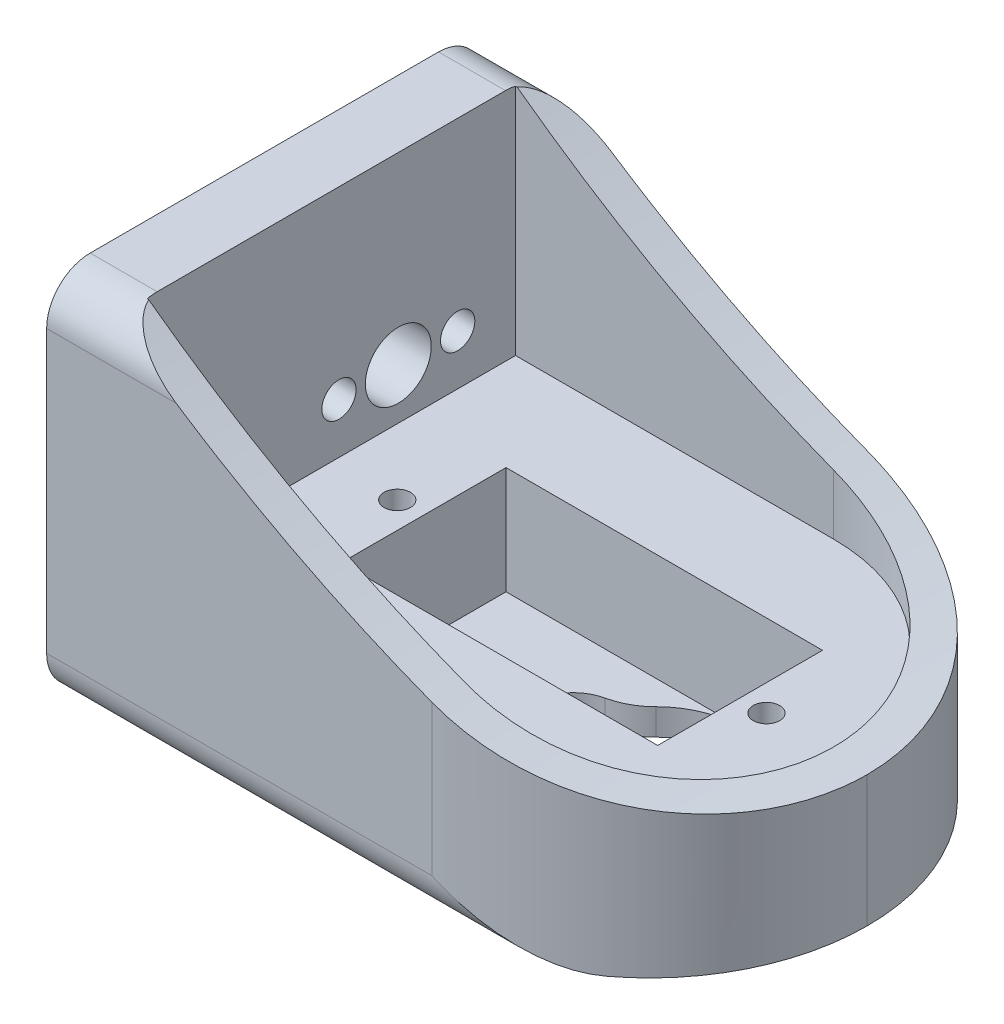
from build123d import *
from OCP.BRepFilletAPI import BRepFilletAPI_MakeFillet

# Parameters (mm, degrees)
BOSS_EXTRUDE1_DEPTH       = 45.72
CUT_EXTRUDE1_DEPTH        = 59.101632507
FILLET2_R                 = 16.51
FILLET3_R                 = 16.51
SKETCH3_OUTSIDE_W         = 60.308
SKETCH3_OUTSIDE_H         = 47.608
CUT_EXTRUDE2_DEPTH        = 52.759317573
SKETCH5_W                 = 24.000000006
SKETCH5_H                 = 12.5
CUT_EXTRUDE3_DEPTH        = 8.16
CUT_EXTRUDE4_DEPTH        = 56.097932423
FILLET4_R1                = 3
FILLET4_R2                = 5
F_2_0MM_DOWEL_HOLE1_D     = 2
F_2_0MM_DOWEL_HOLE1_DEPTH = 8
F_2_0MM_DOWEL_HOLE1_TIP   = 0.600860619
SKETCH11_R                = 2.5
SKETCH11_R_2              = 1.3
CUT_EXTRUDE6_DEPTH        = 5.08
CUT_EXTRUDE7_DEPTH        = 1.5


with BuildPart() as part:
    # Sketch1 → Boss-Extrude1 (new body)
    with BuildSketch(Plane.YZ):
        with BuildLine():
            Line((10.668, -16.51), (-10.668, -16.51))
            ThreePointArc((-10.668, -16.51), (-13.002866591, -15.542866591), (-13.97, -13.208))
            Line((-13.97, -13.208), (-13.97, 13.208))
            ThreePointArc((-13.97, 13.208), (-13.002866591, 15.542866591), (-10.668, 16.51))
            Line((-10.668, 16.51), (10.668, 16.51))
            ThreePointArc((10.668, 16.51), (13.002866591, 15.542866591), (13.97, 13.208))
            Line((13.97, 13.208), (13.97, -13.208))
            ThreePointArc((13.97, -13.208), (13.002866591, -15.542866591), (10.668, -16.51))
        make_face()
    extrude(amount=BOSS_EXTRUDE1_DEPTH)

    # Sketch2 → Cut-Extrude1 (cut, through all)
    with BuildSketch(Plane(origin=(0, 0, -16.51), x_dir=(1, 0, 0), z_dir=(0, 0, -1))):
        with BuildLine():
            Line((5.08, -13.97), (45.72, -13.97))
            Line((45.72, -13.97), (45.72, 4.03))
            add(Edge.make_bspline(
                [(5.08, -13.97), (23.327246471, -0.48405524), (45.72, 4.03)],
                knots=[0, 0, 0, 1, 1, 1], degree=2))
        make_face()
    extrude(amount=-CUT_EXTRUDE1_DEPTH, mode=Mode.SUBTRACT)

    # Fillet2
    # the kernel refuses this fillet: 16.51 mm, written as the material it takes off along each edge
    with BuildSketch(Plane(origin=(45.72, 37.245, -16.51), x_dir=(-1, 0, 0), z_dir=(0, -1, 0))) as fillet2_piece_1:
        with BuildLine():
            CenterArc((FILLET2_R, -FILLET2_R), FILLET2_R, 90, 90)
            Line((0, -FILLET2_R), (0, 0))
            Line((0, 0), (FILLET2_R, 0))
        make_face()
    extrude(amount=89.188, mode=Mode.SUBTRACT)

    # Fillet3
    # the kernel refuses this fillet: 16.51 mm, written as the material it takes off along each edge
    with BuildSketch(Plane(origin=(45.72, -51.943, 16.51), x_dir=(-1, 0, 0), z_dir=(0, 1, 0))) as fillet3_piece_1:
        with BuildLine():
            CenterArc((FILLET3_R, -FILLET3_R), FILLET3_R, 90, 90)
            Line((0, -FILLET3_R), (0, 0))
            Line((0, 0), (FILLET3_R, 0))
        make_face()
    extrude(amount=89.188, mode=Mode.SUBTRACT)

    # Sketch3 outside → Cut-Extrude2 (cut, through all)
    # profile 1 of 2: a face of its own
    with BuildSketch(Plane(origin=(0, -3.81, 0), x_dir=(-1, 0, 0), z_dir=(0, -1, 0))):
        with Locations((-22.86, 0)):
            Rectangle(SKETCH3_OUTSIDE_W, SKETCH3_OUTSIDE_H)
        with BuildLine():
            Line((-29.21, -16.51), (0, -16.51))
            Line((0, -16.51), (0, 16.51))
            Line((0, 16.51), (-29.21, 16.51))
            ThreePointArc((-29.21, 16.51), (-45.72, 0), (-29.21, -16.51))
        make_face(mode=Mode.SUBTRACT)
    # profile 2 of 2: a face of its own
    with BuildSketch(Plane(origin=(0, -3.81, 0), x_dir=(-1, 0, 0), z_dir=(0, -1, 0))):
        with BuildLine():
            Line((-29.21, -13.97), (-5.08, -13.97))
            Line((-5.08, -13.97), (-5.08, 13.97))
            Line((-5.08, 13.97), (-29.21, 13.97))
            ThreePointArc((-29.21, 13.97), (-43.18, 0), (-29.21, -13.97))
        make_face()
    extrude(amount=-CUT_EXTRUDE2_DEPTH, mode=Mode.SUBTRACT)

    # Sketch5 → Cut-Extrude3 (cut)
    with BuildSketch(Plane(origin=(0, -3.81, 0), x_dir=(-1, 0, 0), z_dir=(0, -1, 0))):
        with Locations((-24.080000003, 0)):
            Rectangle(SKETCH5_W, SKETCH5_H)
    extrude(amount=CUT_EXTRUDE3_DEPTH, mode=Mode.SUBTRACT)

    # Sketch6 → Cut-Extrude4 (cut, through all)
    with BuildSketch(Plane(origin=(0, -11.97, 0), x_dir=(-1, 0, 0), z_dir=(0, 1, 0))):
        with BuildLine():
            ThreePointArc((-24.267500006, 3.099974385), (-36.080000006, 0.05), (-24.267500006, -2.999974385))
            ThreePointArc((-24.267500006, -2.999974385), (-20.330000006, 0.05), (-24.267500006, 3.099974385))
        make_face()
    extrude(amount=-CUT_EXTRUDE4_DEPTH, mode=Mode.SUBTRACT)

    # Fillet4: one fillet with a radius per group of edges: ONE call of the kernel's fillet builder (fillet() takes one radius for all edges)
    fillet4_edges_1 = [part.edges().sort_by_distance(p)[0] for p in [
        (24.267500006, -12.97, 3.099974385),
    ]]
    fillet4_edges_2 = [part.edges().sort_by_distance(p)[0] for p in [
        (24.267500006, -12.97, -2.999974385),
    ]]
    fillet4 = BRepFilletAPI_MakeFillet(part.part.solid().wrapped)
    for e in fillet4_edges_1:
        fillet4.Add(FILLET4_R1, e.wrapped)
    for e in fillet4_edges_2:
        fillet4.Add(FILLET4_R2, e.wrapped)
    add(Compound.cast(fillet4.Shape()), mode=Mode.REPLACE)

    # Ø2.0mm Dowel Hole1
    with Locations(Plane(origin=(0, -3.81, 0), x_dir=(-1, 0, 0), z_dir=(0, 1, 0))):
        with Locations((-10.08, 0), (-38.080000006, 0)):
            Hole(F_2_0MM_DOWEL_HOLE1_D / 2, depth=F_2_0MM_DOWEL_HOLE1_DEPTH)
            with Locations((0, 0, -(F_2_0MM_DOWEL_HOLE1_DEPTH + F_2_0MM_DOWEL_HOLE1_TIP / 2))):  # 118° drill point
                Cone(0, F_2_0MM_DOWEL_HOLE1_D / 2, F_2_0MM_DOWEL_HOLE1_TIP, mode=Mode.SUBTRACT)

    # Sketch11 → Cut-Extrude6 (cut)
    with BuildSketch(Plane(origin=(0, 0, 0), x_dir=(0, -1, 0), z_dir=(-1, 0, 0))):
        with Locations(Location((0, -5.08, 0), (0, 0, 90))):
            Circle(SKETCH11_R)
        with Locations(Location((0, -0.58, 0), (0, 0, 90))):
            Circle(SKETCH11_R_2)
        with Locations(Location((0, -9.58, 0), (0, 0, 90))):
            Circle(SKETCH11_R_2)
    extrude(amount=-CUT_EXTRUDE6_DEPTH, mode=Mode.SUBTRACT)

    # Sketch12 → Cut-Extrude7 (cut)
    with BuildSketch(Plane(origin=(0, 0, 0), x_dir=(0, -1, 0), z_dir=(-1, 0, 0))):
        with BuildLine():
            Line((1.3, -9.58), (2.5, -9.58))
            ThreePointArc((2.5, -9.58), (2.118290802, -8.252278614), (1.089724736, -7.33))
            ThreePointArc((1.089724736, -7.33), (0, -7.58), (-1.089724736, -7.33))
            ThreePointArc((-1.089724736, -7.33), (-2.118290802, -8.252278614), (-2.5, -9.58))
            Line((-2.5, -9.58), (-1.3, -9.58))
            ThreePointArc((-1.3, -9.58), (0, -8.28), (1.3, -9.58))
        make_face()
        with BuildLine():
            Line((2.5, -5.08), (2.5, -0.58))
            ThreePointArc((2.5, -0.58), (2.118290802, -1.907721386), (1.089724736, -2.83))
            ThreePointArc((1.089724736, -2.83), (2.118290802, -3.752278614), (2.5, -5.08))
        make_face()
        with BuildLine():
            Line((2.5, -9.58), (2.5, -5.08))
            ThreePointArc((2.5, -5.08), (2.118290802, -6.407721386), (1.089724736, -7.33))
            ThreePointArc((1.089724736, -7.33), (2.118290802, -8.252278614), (2.5, -9.58))
        make_face()
        with BuildLine():
            ThreePointArc((-1.089724736, -7.33), (-2.118290802, -6.407721386), (-2.5, -5.08))
            Line((-2.5, -5.08), (-2.5, -9.58))
            ThreePointArc((-2.5, -9.58), (-2.118290802, -8.252278614), (-1.089724736, -7.33))
        make_face()
        with BuildLine():
            ThreePointArc((-1.089724736, -2.83), (-2.118290802, -1.907721386), (-2.5, -0.58))
            Line((-2.5, -0.58), (-2.5, -5.08))
            ThreePointArc((-2.5, -5.08), (-2.118290802, -3.752278614), (-1.089724736, -2.83))
        make_face()
        with BuildLine():
            ThreePointArc((1.089724736, -2.83), (2.118290802, -1.907721386), (2.5, -0.58))
            Line((2.5, -0.58), (1.3, -0.58))
            ThreePointArc((1.3, -0.58), (0, -1.88), (-1.3, -0.58))
            Line((-1.3, -0.58), (-2.5, -0.58))
            ThreePointArc((-2.5, -0.58), (-2.118290802, -1.907721386), (-1.089724736, -2.83))
            ThreePointArc((-1.089724736, -2.83), (0, -2.58), (1.089724736, -2.83))
        make_face()
        with BuildLine():
            Line((1.3, -0.58), (2.5, -0.58))
            ThreePointArc((2.5, -0.58), (0, 1.92), (-2.5, -0.58))
            Line((-2.5, -0.58), (-1.3, -0.58))
            ThreePointArc((-1.3, -0.58), (0, 0.72), (1.3, -0.58))
        make_face()
        with BuildLine():
            ThreePointArc((-2.5, -9.58), (0, -12.08), (2.5, -9.58))
            Line((2.5, -9.58), (1.3, -9.58))
            ThreePointArc((1.3, -9.58), (0, -10.88), (-1.3, -9.58))
            Line((-1.3, -9.58), (-2.5, -9.58))
        make_face()
    extrude(amount=-CUT_EXTRUDE7_DEPTH, mode=Mode.SUBTRACT)


solid = part.part
